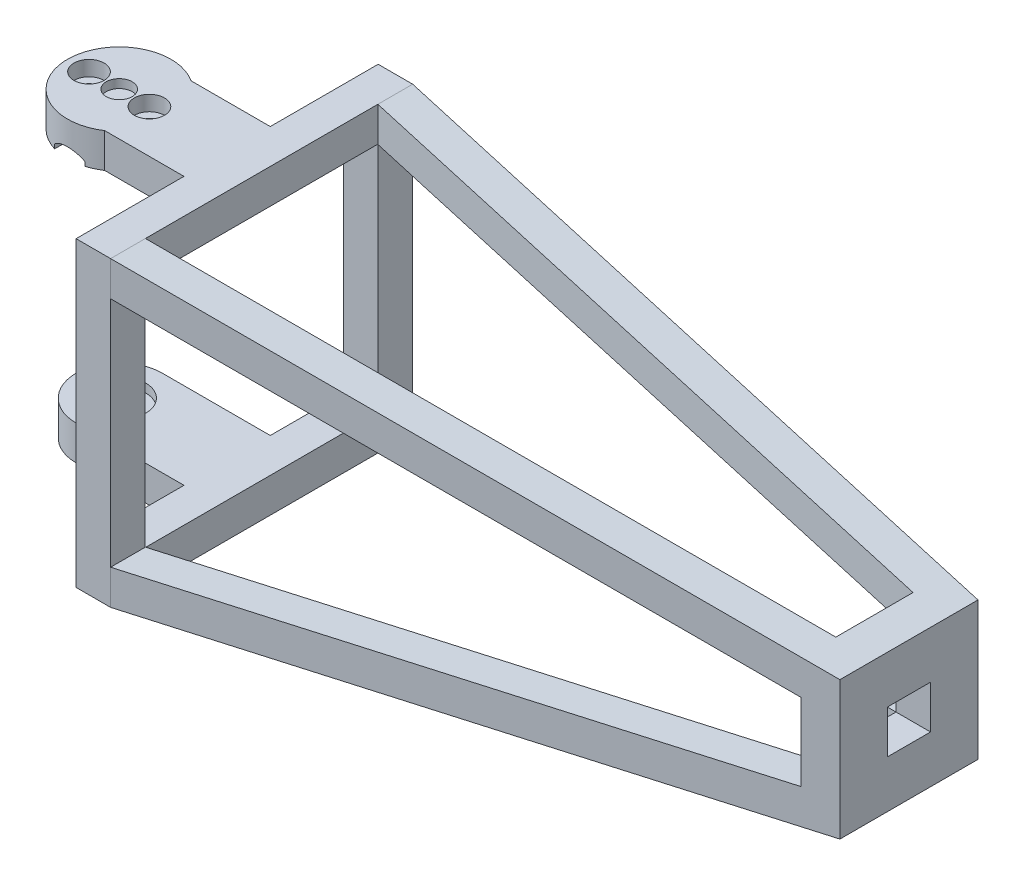
from build123d import *

# Parameters (mm, degrees)
SZKIC1_W                        = 43
SZKIC1_H                        = 20
SZKIC1_R                        = 2.1
DODANIE_WYCI_GNI_CIE1_DEPTH     = 8
SZKIC2_R                        = 6.1
WYTNIJ_WYCI_GNI_CIE1_DEPTH      = 2
WYTNIJ_WYCI_GNI_CIE2_START      = -1.5
SZKIC3_R                        = 6.1
WYTNIJ_WYCI_GNI_CIE2_DEPTH      = 1.5
SZKIC4_W                        = 8
SZKIC4_H                        = 20
DODANIE_WYCI_GNI_CIE2_DEPTH     = 54
ZAOKR_GLENIE1_R                 = 10
DODANIE_WYCI_GNI_CIE3_DEPTH     = 8
WYTNIJ_WYCI_GNI_CIE3_REACH      = 80.313
SZKIC6_R                        = 1.6
SZKIC7_R                        = 3.5
WYTNIJ_WYCI_GNI_CIE4_DEPTH      = 3.5
WYTNIJ_WYCI_GNI_CIE5_REACH      = 83.025
WYTNIJ_WYCI_GNI_CIE5_END_RADIUS = 12
SZKIC10_R                       = 3
WYTNIJ_WYCI_GNI_CIE6_DEPTH      = 2
SZKIC13_W                       = 25
SZKIC13_H                       = 70
DODANIE_WYCI_GNI_CIE4_DEPTH     = 8
WYTNIJ_WYCI_GNI_CIE7_REACH      = 88.568
SZKIC14_W                       = 54
SZKIC14_H                       = 54
DODANIE_WYCI_GNI_CIE5_DEPTH     = 70
WYTNIJ_WYCI_GNI_CIE9_DEPTH      = 209.060087508
WYTNIJ_WYCI_GNI_CIE10_REACH     = 212.119
SZKIC20_W                       = 10
SZKIC20_H                       = 10


with BuildPart() as part:
    # Szkic1 → Dodanie-wyciągnięcie1 (new body)
    with BuildSketch(Plane(origin=(0, 0, 0), x_dir=(1, 0, 0), z_dir=(0, 1, 0))):
        with Locations((11.5, 0)):
            Rectangle(SZKIC1_W, SZKIC1_H)
        with Locations(Location((0, 0, 0), (0, 0, 270))):
            Circle(SZKIC1_R, mode=Mode.SUBTRACT)
    extrude(amount=DODANIE_WYCI_GNI_CIE1_DEPTH)

    # Szkic2 → Wytnij-wyciągnięcie1 (cut)
    with BuildSketch(Plane(origin=(0, 8, 0), x_dir=(1, 0, 0), z_dir=(0, 1, 0))):
        with Locations(Location((0, 0, 0), (0, 0, 270))):
            Circle(SZKIC2_R)
    extrude(amount=-WYTNIJ_WYCI_GNI_CIE1_DEPTH, mode=Mode.SUBTRACT)

    # Szkic3 → Wytnij-wyciągnięcie2 (cut)
    with BuildSketch(Plane.XZ.offset(WYTNIJ_WYCI_GNI_CIE2_START)):
        with Locations(Location((0, 0, 0), (0, 0, 90))):
            Circle(SZKIC3_R)
    extrude(amount=WYTNIJ_WYCI_GNI_CIE2_DEPTH, mode=Mode.SUBTRACT)

    # Szkic4 → Dodanie-wyciągnięcie2 (add)
    with BuildSketch(Plane(origin=(0, 8, 0), x_dir=(1, 0, 0), z_dir=(0, 1, 0))):
        with Locations((29, 0)):
            Rectangle(SZKIC4_W, SZKIC4_H)
    extrude(amount=DODANIE_WYCI_GNI_CIE2_DEPTH)

    # Zaokrąglenie1
    zaokr_glenie1_edges = [part.edges().sort_by_distance(p)[0] for p in [
        (-10, 4, -10),
        (-10, 4, 10),
    ]]
    fillet(zaokr_glenie1_edges, radius=ZAOKR_GLENIE1_R - 0.0001)  # a hair under: the kernel refuses the full size

    # Szkic5 → Dodanie-wyciągnięcie3 (add)
    with BuildSketch(Plane(origin=(0, 62, 0), x_dir=(1, 0, 0), z_dir=(0, 1, 0))):
        with BuildLine():
            Line((33, -10), (33, 10))
            Line((33, 10), (6.633249581, 10))
            ThreePointArc((6.633249581, 10), (-12, 0), (6.633249581, -10))
            Line((6.633249581, -10), (33, -10))
        make_face()
    extrude(amount=DODANIE_WYCI_GNI_CIE3_DEPTH)

    # Szkic6 → Wytnij-wyciągnięcie3 (cut, up to next)
    with BuildSketch(Plane(origin=(0, 70, 0), x_dir=(1, 0, 0), z_dir=(0, 1, 0)), mode=Mode.PRIVATE) as wytnij_wyci_gni_cie3_sk1:
        with Locations(Location((-7, 0, 0), (0, 0, 270))):
            Circle(SZKIC6_R)
    wytnij_wyci_gni_cie3_tool1 = extrude(wytnij_wyci_gni_cie3_sk1.sketch, amount=-WYTNIJ_WYCI_GNI_CIE3_REACH, mode=Mode.PRIVATE) & part.part
    # Szkic6 → Wytnij-wyciągnięcie3 (cut, up to next)
    with BuildSketch(Plane(origin=(0, 70, 0), x_dir=(1, 0, 0), z_dir=(0, 1, 0)), mode=Mode.PRIVATE) as wytnij_wyci_gni_cie3_sk2:
        with Locations(Location((7, 0, 0), (0, 0, 270))):
            Circle(SZKIC6_R)
    wytnij_wyci_gni_cie3_tool2 = extrude(wytnij_wyci_gni_cie3_sk2.sketch, amount=-WYTNIJ_WYCI_GNI_CIE3_REACH, mode=Mode.PRIVATE) & part.part
    add(wytnij_wyci_gni_cie3_tool1.solids().sort_by_distance((-7, 70, 0))[0], mode=Mode.SUBTRACT)
    add(wytnij_wyci_gni_cie3_tool2.solids().sort_by_distance((7, 70, 0))[0], mode=Mode.SUBTRACT)

    # Szkic7 → Wytnij-wyciągnięcie4 (cut)
    with BuildSketch(Plane(origin=(0, 70, 0), x_dir=(1, 0, 0), z_dir=(0, 1, 0))):
        with Locations(Location((7, 0, 0), (0, 0, 270))):
            Circle(SZKIC7_R)
        with Locations(Location((-7, 0, 0), (0, 0, 270))):
            Circle(SZKIC7_R)
    extrude(amount=-WYTNIJ_WYCI_GNI_CIE4_DEPTH, mode=Mode.SUBTRACT)

    # Wytnij-wyciągnięcie5: up to this cylinder (the profile starts inside it)
    wytnij_wyci_gni_cie5_end = Plane(origin=(0, 63.035303, 0), z_dir=(0, -1, 0)) * Cylinder(WYTNIJ_WYCI_GNI_CIE5_END_RADIUS, 191.05, mode=Mode.PRIVATE)
    # Szkic9 → Wytnij-wyciągnięcie5 (cut, up to the surface)
    with BuildSketch(Plane.XY.offset(12), mode=Mode.PRIVATE) as wytnij_wyci_gni_cie5_sk1:
        with BuildLine():
            Line((-3.5, 62), (3.5, 62))
            Line((3.5, 62), (3.5, 63))
            ThreePointArc((3.5, 63), (0, 64.429285786), (-3.5, 63))
            Line((-3.5, 63), (-3.5, 62))
        make_face()
    wytnij_wyci_gni_cie5_tool1 = extrude(wytnij_wyci_gni_cie5_sk1.sketch, amount=-WYTNIJ_WYCI_GNI_CIE5_REACH, mode=Mode.PRIVATE) & wytnij_wyci_gni_cie5_end
    add(wytnij_wyci_gni_cie5_tool1.solids().sort_by_distance((0, 63.035303, 12))[0], mode=Mode.SUBTRACT)

    # Szkic10 → Wytnij-wyciągnięcie6 (cut)
    with BuildSketch(Plane(origin=(0, 70, 0), x_dir=(1, 0, 0), z_dir=(0, 1, 0))):
        with Locations(Location((0, 0, 0), (0, 0, 270))):
            Circle(SZKIC10_R)
    extrude(amount=-WYTNIJ_WYCI_GNI_CIE6_DEPTH, mode=Mode.SUBTRACT)

    # Szkic13 → Dodanie-wyciągnięcie4 (add)
    with BuildSketch(Plane(origin=(33, 0, 0), x_dir=(0, 0, -1), z_dir=(1, 0, 0))):
        with Locations((22.5, 35)):
            Rectangle(SZKIC13_W, SZKIC13_H)
        with Locations((-22.5, 35)):
            Rectangle(SZKIC13_W, SZKIC13_H)
    extrude(amount=-DODANIE_WYCI_GNI_CIE4_DEPTH)

    # Szkic14 → Wytnij-wyciągnięcie7 (cut, up to next)
    with BuildSketch(Plane.ZY.offset(-25), mode=Mode.PRIVATE) as wytnij_wyci_gni_cie7_sk1:
        with Locations((0, 35)):
            Rectangle(SZKIC14_W, SZKIC14_H)
    wytnij_wyci_gni_cie7_tool1 = extrude(wytnij_wyci_gni_cie7_sk1.sketch, amount=-WYTNIJ_WYCI_GNI_CIE7_REACH, mode=Mode.PRIVATE) & part.part
    add(wytnij_wyci_gni_cie7_tool1.solids().sort_by_distance((25, 35, 0))[0], mode=Mode.SUBTRACT)

    # Szkic17 → Dodanie-wyciągnięcie5 (add, through all)
    with BuildSketch(Plane.XZ):
        Polygon((33, 35), (183, 16), (183, -16), (33, -35), (33, -26.936077602), (175, -8.949410935), (175, 8.949410935), (33, 26.936077602), align=None)
    extrude(amount=-DODANIE_WYCI_GNI_CIE5_DEPTH)

    # Szkic18 → Wytnij-wyciągnięcie9 (cut, through all)
    with BuildSketch(Plane(origin=(0, 0, -35), x_dir=(-1, 0, 0), z_dir=(0, 0, -1))):
        Polygon((-33, 70), (-183, 70), (-183, 51), align=None)
        Polygon((-183, 0), (-183, 19), (-33, 0), align=None)
        Polygon((-33, 8.063922398), (-33, 61.936077602), (-175, 43.949410935), (-175, 26.050589065), align=None)
    extrude(amount=-WYTNIJ_WYCI_GNI_CIE9_DEPTH, mode=Mode.SUBTRACT)

    # Szkic20 → Wytnij-wyciągnięcie10 (cut, up to next)
    with BuildSketch(Plane(origin=(183, 0, 0), x_dir=(0, 0, -1), z_dir=(1, 0, 0)), mode=Mode.PRIVATE) as wytnij_wyci_gni_cie10_sk1:
        with Locations((0, 35)):
            Rectangle(SZKIC20_W, SZKIC20_H)
    wytnij_wyci_gni_cie10_tool1 = extrude(wytnij_wyci_gni_cie10_sk1.sketch, amount=-WYTNIJ_WYCI_GNI_CIE10_REACH, mode=Mode.PRIVATE) & part.part
    add(wytnij_wyci_gni_cie10_tool1.solids().sort_by_distance((183, 35, 0))[0], mode=Mode.SUBTRACT)


solid = part.part
